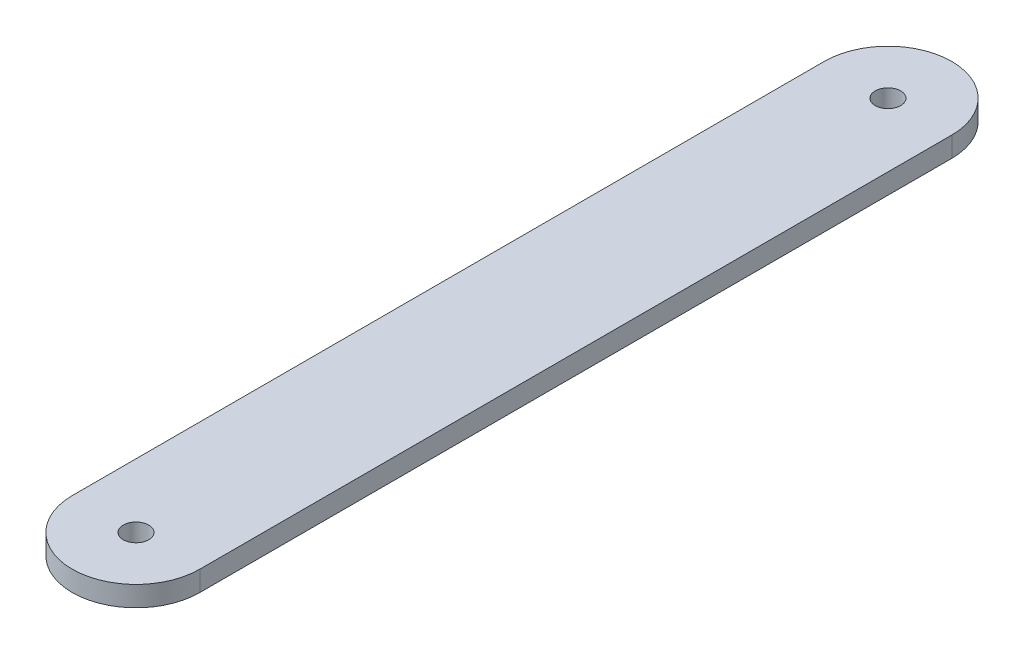
from build123d import *

# Parameters (mm, degrees)
SKETCH2_R           = 1
BOSS_EXTRUDE1_DEPTH = 1.5875


with BuildPart() as part:
    # Sketch2 → Boss-Extrude1 (new body)
    with BuildSketch(Plane(origin=(0, 0, 0), x_dir=(1, 0, 0), z_dir=(0, 1, 0))):
        with BuildLine():
            Line((-5, 58.9716), (-5, 0))
            ThreePointArc((-5, 0), (0, -5), (5, 0))
            Line((5, 0), (5, 58.9716))
            ThreePointArc((5, 58.9716), (0, 63.9716), (-5, 58.9716))
        make_face()
        Circle(SKETCH2_R, mode=Mode.SUBTRACT)
        with Locations((0, 58.9716)):
            Circle(SKETCH2_R, mode=Mode.SUBTRACT)
    extrude(amount=BOSS_EXTRUDE1_DEPTH)


solid = part.part
